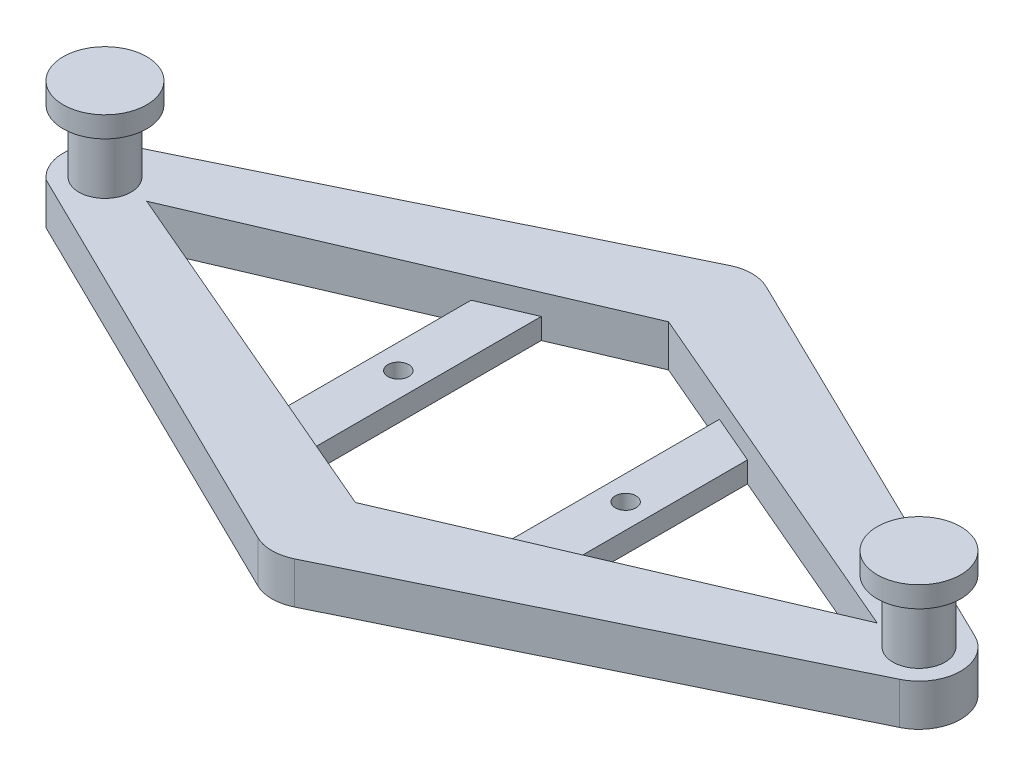
from build123d import *

# Parameters (mm, degrees)
BOSS_EXTRUDE1_DEPTH   = 5.08
SKETCH5_R             = 3.175
BOSS_EXTRUDE2_DEPTH   = 7.62
SKETCH12_R            = 5.08
BOSS_EXTRUDE4_DEPTH   = 2.54
SKETCH14_R            = 5.08
BOSS_EXTRUDE5_DEPTH   = 2.54
SKETCH15_R            = 1.27
BOSS_EXTRUDE6_DEPTH   = 2.54
BOSS_EXTRUDE6_2_DEPTH = 2.54


with BuildPart() as part:
    # Sketch4 → Boss-Extrude1 (new body)
    with BuildSketch(Plane(origin=(0, 0, 0), x_dir=(1, 0, 0), z_dir=(0, 1, 0))):
        with BuildLine():
            Line((-51.75488467, 4.566868534), (-2.22488467, 28.696868534))
            ThreePointArc((-2.22488467, 28.696868534), (1.2433e-05, 29.21), (2.224907024, 28.696857643))
            Line((2.224907024, 28.696857643), (51.70773276, 4.589540285))
            ThreePointArc((51.70773276, 4.589540285), (54.609932644, 0.026159658), (51.75488467, -4.566868534))
            Line((51.75488467, -4.566868534), (2.22488467, -28.696868534))
            ThreePointArc((2.22488467, -28.696868534), (-0.00727814, -29.209994786), (-2.237961471, -28.690474587))
            Line((-2.237961471, -28.690474587), (-52.826499461, -3.865163813))
            ThreePointArc((-52.826499461, -3.865163813), (-54.569465553, 0.640458386), (-51.75488467, 4.566868534))
        make_face()
        Polygon((-44.45, 0), (0, 19.05), (44.45, 0), (0, -19.05), align=None, mode=Mode.SUBTRACT)
    extrude(amount=BOSS_EXTRUDE1_DEPTH)

    # Sketch5 → Boss-Extrude2 (add)
    with BuildSketch(Plane(origin=(0, 5.08, 0), x_dir=(1, 0, 0), z_dir=(0, 1, 0))):
        with Locations((-49.53, 0)):
            Circle(SKETCH5_R)
        with Locations((49.53, 0)):
            Circle(SKETCH5_R)
    extrude(amount=BOSS_EXTRUDE2_DEPTH)

    # Sketch12 → Boss-Extrude4 (add)
    with BuildSketch(Plane(origin=(0, 12.7, 0), x_dir=(1, 0, 0), z_dir=(0, 1, 0))):
        with Locations((49.53, 0)):
            Circle(SKETCH12_R)
    extrude(amount=BOSS_EXTRUDE4_DEPTH)

    # Sketch14 → Boss-Extrude5 (add)
    with BuildSketch(Plane(origin=(0, 12.7, 0), x_dir=(1, 0, 0), z_dir=(0, 1, 0))):
        with Locations((-49.53, 0)):
            Circle(SKETCH14_R)
    extrude(amount=BOSS_EXTRUDE5_DEPTH)


with BuildPart() as body_2:
    # Sketch15 → Boss-Extrude6 (new body)
    with BuildSketch(Plane(origin=(0, 0, 0), x_dir=(1, 0, 0), z_dir=(0, 1, 0))):
        Polygon((-10.839034868, 14.404699342), (-10.839034868, -14.404699342), (-16.823699484, -11.839843078), (-16.823699484, 11.839843078), align=None)
        with Locations((-13.831367176, 0)):
            Circle(SKETCH15_R, mode=Mode.SUBTRACT)
    extrude(amount=BOSS_EXTRUDE6_DEPTH)


with BuildPart() as body_3:
    # Sketch15 → Boss-Extrude6 2 (new body)
    with BuildSketch(Plane(origin=(0, 0, 0), x_dir=(1, 0, 0), z_dir=(0, 1, 0))):
        Polygon((16.823699484, 11.839843078), (10.839034868, 14.404699342), (10.839034868, -14.404699342), (16.823699484, -11.839843078), align=None)
        with Locations((13.831367176, 0)):
            Circle(SKETCH15_R, mode=Mode.SUBTRACT)
    extrude(amount=BOSS_EXTRUDE6_2_DEPTH)


solid = Compound([part.part, body_2.part, body_3.part])
